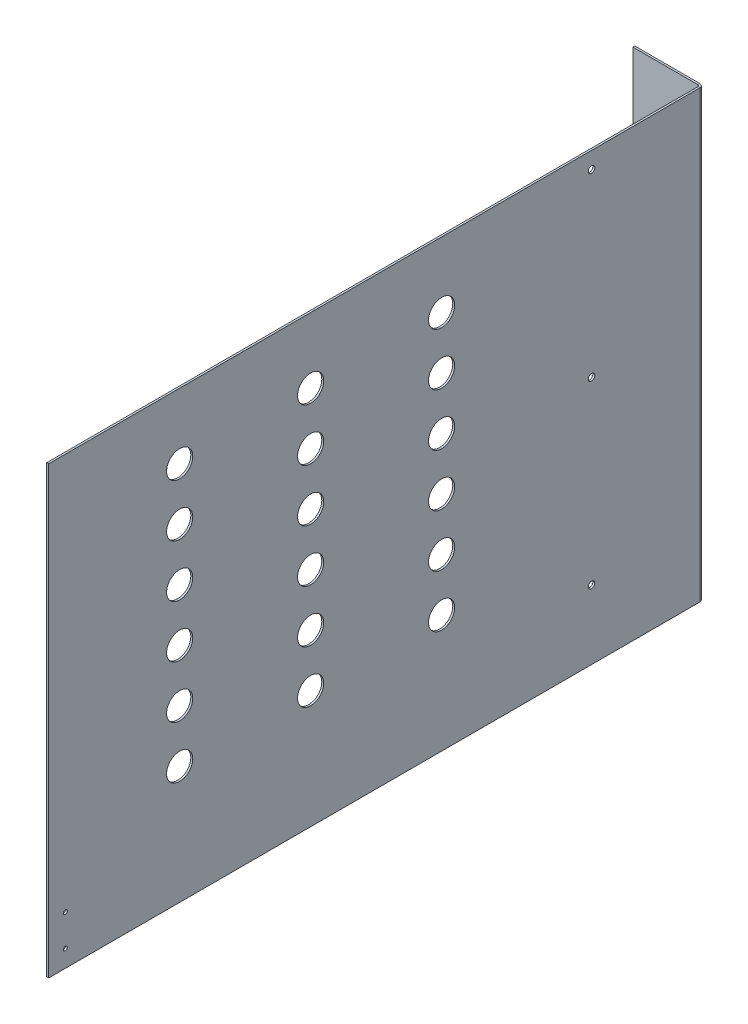
from build123d import *

# Parameters (mm, degrees)
SKETCH1_W                  = 340
SKETCH1_H                  = 550
BOSS_EXTRUDE1_DEPTH        = 1.3
F_20_0_20_DIAMETER_HOLE1_D = 20
F_5_0_5_DIAMETER_HOLE1_D   = 5
CONVERT_SOLID1_START       = -0.2
CONVERT_SOLID1_OUTLINE_W   = 340
CONVERT_SOLID1_OUTLINE_H   = 550
CONVERT_SOLID1_OUTLINE_R   = 2.5
CONVERT_SOLID1_OUTLINE_R_2 = 10
CONVERT_SOLID1_DEPTH       = 0.2
SKETCHED_START             = -275
SKETCHED_BEND1_OUTLINE_W   = 1.5
SKETCHED_BEND1_OUTLINE_H   = 340
SKETCHED_BEND1_DEPTH       = 50.30822
SKETCHED_START_2           = -225
SKETCHED_BEND1_2_OUTLINE_W = 50.965708265
SKETCHED_BEND1_2_OUTLINE_H = 340
SKETCHED_BEND1_2_OUTLINE_R = 2.5
SKETCHED_BEND1_2_DEPTH     = 3
SKETCHED_START_3           = -171
SKETCHED_BEND1_3_DEPTH     = 342
CUT_EXTRUDE1_DEPTH         = 328.32694619
CUT_EXTRUDE1_DEPTH_BACK    = 328.32694619
SKETCH1_3_R                = 1.5


with BuildPart() as part:
    # Sketch1 → Boss-Extrude1 (new body)
    with BuildSketch(Plane.YZ):
        Rectangle(SKETCH1_W, SKETCH1_H)
    extrude(amount=BOSS_EXTRUDE1_DEPTH)

    # Ø20.0 (20) Diameter Hole1 (through all)
    with Locations(Plane.YZ.offset(1.3)):
        with Locations((80, -25), (40, -25), (120, -25), (0, -25), (-40, -25), (-80, -25), (120, 75), (80, 75), (40, 75), (0, 75), (-40, 75), (-80, 75), (120, 175), (80, 175), (40, 175), (0, 175), (-40, 175), (-80, 175)):
            Hole(F_20_0_20_DIAMETER_HOLE1_D / 2)

    # Ø5.0 (5) Diameter Hole1 (through all)
    with Locations(Plane.YZ.offset(1.3)):
        with Locations((157.3, -139.45), (20, -139.45), (-117.3, -139.45), (140, -250), (0, -250), (-140, -250)):
            Hole(F_5_0_5_DIAMETER_HOLE1_D / 2)

    # Convert-Solid1: read off the stored shape, not the designer's step
    # Convert-Solid1 outline → Convert-Solid1 (add)
    with BuildSketch(Plane.YZ.offset(CONVERT_SOLID1_START)):
        Rectangle(CONVERT_SOLID1_OUTLINE_W, CONVERT_SOLID1_OUTLINE_H)
        with Locations((-140, -250)):
            Circle(CONVERT_SOLID1_OUTLINE_R, mode=Mode.SUBTRACT)
        with Locations((-117.3, -139.45)):
            Circle(CONVERT_SOLID1_OUTLINE_R, mode=Mode.SUBTRACT)
        with Locations((-80, -25)):
            Circle(CONVERT_SOLID1_OUTLINE_R_2, mode=Mode.SUBTRACT)
        with Locations((-40, -25)):
            Circle(CONVERT_SOLID1_OUTLINE_R_2, mode=Mode.SUBTRACT)
        with Locations((0, -250)):
            Circle(CONVERT_SOLID1_OUTLINE_R, mode=Mode.SUBTRACT)
        with Locations((20, -139.45)):
            Circle(CONVERT_SOLID1_OUTLINE_R, mode=Mode.SUBTRACT)
        with Locations((140, -250)):
            Circle(CONVERT_SOLID1_OUTLINE_R, mode=Mode.SUBTRACT)
        with Locations((157.3, -139.45)):
            Circle(CONVERT_SOLID1_OUTLINE_R, mode=Mode.SUBTRACT)
        with Locations((0, -25)):
            Circle(CONVERT_SOLID1_OUTLINE_R_2, mode=Mode.SUBTRACT)
        with Locations((40, -25)):
            Circle(CONVERT_SOLID1_OUTLINE_R_2, mode=Mode.SUBTRACT)
        with Locations((80, -25)):
            Circle(CONVERT_SOLID1_OUTLINE_R_2, mode=Mode.SUBTRACT)
        with Locations((120, -25)):
            Circle(CONVERT_SOLID1_OUTLINE_R_2, mode=Mode.SUBTRACT)
        with Locations((-80, 75)):
            Circle(CONVERT_SOLID1_OUTLINE_R_2, mode=Mode.SUBTRACT)
        with Locations((-40, 75)):
            Circle(CONVERT_SOLID1_OUTLINE_R_2, mode=Mode.SUBTRACT)
        with Locations((-80, 175)):
            Circle(CONVERT_SOLID1_OUTLINE_R_2, mode=Mode.SUBTRACT)
        with Locations((-40, 175)):
            Circle(CONVERT_SOLID1_OUTLINE_R_2, mode=Mode.SUBTRACT)
        with Locations((0, 75)):
            Circle(CONVERT_SOLID1_OUTLINE_R_2, mode=Mode.SUBTRACT)
        with Locations((40, 75)):
            Circle(CONVERT_SOLID1_OUTLINE_R_2, mode=Mode.SUBTRACT)
        with Locations((80, 75)):
            Circle(CONVERT_SOLID1_OUTLINE_R_2, mode=Mode.SUBTRACT)
        with Locations((120, 75)):
            Circle(CONVERT_SOLID1_OUTLINE_R_2, mode=Mode.SUBTRACT)
        with Locations((0, 175)):
            Circle(CONVERT_SOLID1_OUTLINE_R_2, mode=Mode.SUBTRACT)
        with Locations((40, 175)):
            Circle(CONVERT_SOLID1_OUTLINE_R_2, mode=Mode.SUBTRACT)
        with Locations((80, 175)):
            Circle(CONVERT_SOLID1_OUTLINE_R_2, mode=Mode.SUBTRACT)
        with Locations((120, 175)):
            Circle(CONVERT_SOLID1_OUTLINE_R_2, mode=Mode.SUBTRACT)
    extrude(amount=CONVERT_SOLID1_DEPTH)

    # Sketched Bend1: read off the stored shape, not the designer's step
    # Sketched Bend1 outline → Sketched Bend1 (cut)
    with BuildSketch(Plane.XY.offset(SKETCHED_START)):
        with Locations((0.55, 0)):
            Rectangle(SKETCHED_BEND1_OUTLINE_W, SKETCHED_BEND1_OUTLINE_H)
    extrude(amount=SKETCHED_BEND1_DEPTH, mode=Mode.SUBTRACT)

    # Sketched Bend1 2 outline → Sketched Bend1 2 (add)
    with BuildSketch(Plane.XY.offset(SKETCHED_START_2)):
        with Locations((-25.682854133, 0)):
            Rectangle(SKETCHED_BEND1_2_OUTLINE_W, SKETCHED_BEND1_2_OUTLINE_H)
        with Locations((-26.165708265, -140)):
            Circle(SKETCHED_BEND1_2_OUTLINE_R, mode=Mode.SUBTRACT)
        with Locations((-26.165708265, 0)):
            Circle(SKETCHED_BEND1_2_OUTLINE_R, mode=Mode.SUBTRACT)
        with Locations((-26.165708265, 140)):
            Circle(SKETCHED_BEND1_2_OUTLINE_R, mode=Mode.SUBTRACT)
    extrude(amount=SKETCHED_BEND1_2_DEPTH)

    # Sketched Bend1 3 outline → Sketched Bend1 3 (cut)
    with BuildSketch(Plane(origin=(0, 0, 0), x_dir=(1, 0, 0), z_dir=(0, 1, 0)).offset(SKETCHED_START_3)):
        with BuildLine():
            ThreePointArc((-0.2, 222), (-0.639339828, 223.060660172), (-1.7, 223.5))
            Line((-1.7, 223.5), (-51.165708265, 223.5))
            Line((-51.165708265, 223.5), (-51.165708265, 222))
            Line((-51.165708265, 222), (-0.2, 222))
        make_face()
        with BuildLine():
            Line((-0.2, 225), (-1.7, 225))
            ThreePointArc((-1.7, 225), (0.421320344, 224.121320344), (1.3, 222))
            Line((1.3, 222), (1.3, 224.69178))
            Line((1.3, 224.69178), (-0.2, 224.69178))
            Line((-0.2, 224.69178), (-0.2, 225))
        make_face()
    extrude(amount=SKETCHED_BEND1_3_DEPTH, mode=Mode.SUBTRACT)

    # Sketch1<3> → Cut-Extrude1 (cut, two sides: drawn at the far end of the back side and taken through both)
    with BuildSketch(Plane.YZ.offset(-CUT_EXTRUDE1_DEPTH_BACK)):
        with Locations(Location((-132.789034574, 262.3, 0), (0, 0, 270))):
            Circle(SKETCH1_3_R)
        with Locations(Location((-156.891480577, 262.3, 0), (0, 0, 270))):
            Circle(SKETCH1_3_R)
    extrude(amount=CUT_EXTRUDE1_DEPTH + CUT_EXTRUDE1_DEPTH_BACK, mode=Mode.SUBTRACT)


solid = part.part
